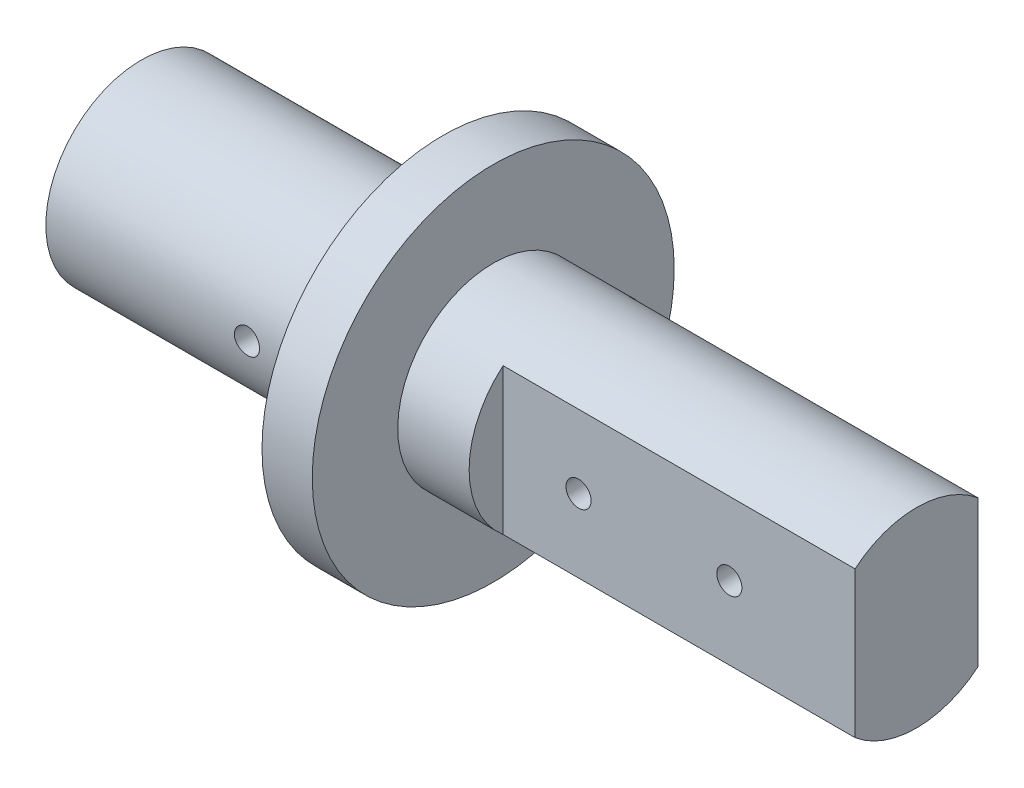
from build123d import *
from build123d.topology import SkipClean

# Parameters (mm, degrees)
SKETCH1_W                           = 42.1
SKETCH1_H                           = 10
BOSS_EXTRUDE1_START                 = 30
BOSS_EXTRUDE1_DEPTH                 = 30
BOSS_EXTRUDE2_START                 = -7.1
SKETCH8_R                           = 18
BOSS_EXTRUDE2_DEPTH                 = 5
M3X0_5_TAPPED_HOLE3_D               = 2.5
M3X0_5_TAPPED_HOLE3_DEPTH           = 10
M3X0_5_TAPPED_HOLE3_TIP             = 0.751076
M3X0_5_TAPPED_HOLE2_D               = 2.5
M3X0_5_TAPPED_HOLE2_DEPTH           = 5
M3X0_5_TAPPED_HOLE2_TIP             = 0.751076
M3X0_5_TAPPED_HOLE2_ON_FACE_2_D     = 2.5
M3X0_5_TAPPED_HOLE2_ON_FACE_2_DEPTH = 5
M3X0_5_TAPPED_HOLE2_ON_FACE_2_TIP   = 0.751076
BOSS_EXTRUDE3_START                 = 5
BOSS_EXTRUDE3_DEPTH                 = 5
TOLERANCING_START                   = 42.1
TOLERANCING_DEPTH                   = 35
TOLERANCING_2_OUTLINE_R             = 10
TOLERANCING_2_OUTLINE_R_2           = 9.5
TOLERANCING_2_DEPTH                 = 30
TOLERANCING_START_2                 = 35
TOLERANCING_3_OUTLINE_R             = 10
TOLERANCING_3_OUTLINE_R_2           = 9.5
TOLERANCING_3_DEPTH                 = 7.1


# Read off the part's stored shape, not the designer's step: Tolerancing
with BuildPart() as part:
    # Sketch1 → Revolve1 (revolve)
    with BuildSketch(Plane.XY, mode=Mode.PRIVATE) as revolve1_sk:
        with Locations((21.05, 5)):
            Rectangle(SKETCH1_W, SKETCH1_H)
    revolve(revolve1_sk.sketch.rotate(Axis((0, 0, 0), (1, 0, 0)), 90), axis=Axis((0, 0, 0), (1, 0, 0)))

    # Sketch3 → Boss-Extrude1 (add)
    with BuildSketch(Plane(origin=(42.1, 0, 0), x_dir=(0, 0, -1), z_dir=(1, 0, 0)).offset(BOSS_EXTRUDE1_START)):
        with BuildLine():
            Line((-6.614378, -7.5), (-6.614378, 7.5))
            ThreePointArc((-6.614378, 7.5), (0, 10), (6.614378, 7.5))
            Line((6.614378, 7.5), (6.614378, -7.5))
            ThreePointArc((6.614378, -7.5), (0, -10), (-6.614378, -7.5))
        make_face()
    extrude(amount=-BOSS_EXTRUDE1_DEPTH)

    # Sketch8 → Boss-Extrude2 (add)
    with BuildSketch(Plane(origin=(42.1, 0, 0), x_dir=(0, 0, -1), z_dir=(1, 0, 0)).offset(BOSS_EXTRUDE2_START)):
        Circle(SKETCH8_R)
    extrude(amount=-BOSS_EXTRUDE2_DEPTH)

    # M3x0.5 Tapped Hole3
    with Locations(Plane.XY.offset(10)):
        with Locations((20, 0)):
            Hole(M3X0_5_TAPPED_HOLE3_D / 2, depth=M3X0_5_TAPPED_HOLE3_DEPTH)
            with Locations((0, 0, -(M3X0_5_TAPPED_HOLE3_DEPTH + M3X0_5_TAPPED_HOLE3_TIP / 2))):  # 118° drill point
                Cone(0, M3X0_5_TAPPED_HOLE3_D / 2, M3X0_5_TAPPED_HOLE3_TIP, mode=Mode.SUBTRACT)

    # M3x0.5 Tapped Hole2
    with Locations(Plane(origin=(49.6, 0, 6.614378), x_dir=(1, 0, 0), z_dir=(0, 0, 1))):
        with Locations((0, 0), (15, 0)):
            Hole(M3X0_5_TAPPED_HOLE2_D / 2, depth=M3X0_5_TAPPED_HOLE2_DEPTH)
            with Locations((0, 0, -(M3X0_5_TAPPED_HOLE2_DEPTH + M3X0_5_TAPPED_HOLE2_TIP / 2))):  # 118° drill point
                Cone(0, M3X0_5_TAPPED_HOLE2_D / 2, M3X0_5_TAPPED_HOLE2_TIP, mode=Mode.SUBTRACT)

    # M3x0.5 Tapped Hole2 on face 2
    with Locations(Plane(origin=(64.6, 0, -6.614378), x_dir=(-1, 0, 0), z_dir=(0, 0, -1))):
        with Locations((0, 0), (15, 0)):
            Hole(M3X0_5_TAPPED_HOLE2_ON_FACE_2_D / 2, depth=M3X0_5_TAPPED_HOLE2_ON_FACE_2_DEPTH)
            with Locations((0, 0, -(M3X0_5_TAPPED_HOLE2_ON_FACE_2_DEPTH + M3X0_5_TAPPED_HOLE2_ON_FACE_2_TIP / 2))):  # 118° drill point
                Cone(0, M3X0_5_TAPPED_HOLE2_ON_FACE_2_D / 2, M3X0_5_TAPPED_HOLE2_ON_FACE_2_TIP, mode=Mode.SUBTRACT)

    # Sketch9 → Boss-Extrude3 (add)
    with SkipClean():  # the faces are left unmerged after this step: merging them gives an invalid solid
        with BuildSketch(Plane(origin=(72.1, 0, 0), x_dir=(0, 0, -1), z_dir=(1, 0, 0)).offset(BOSS_EXTRUDE3_START)):
            with BuildLine():
                Line((6.614378, -7.5), (6.614378, 7.5))
                ThreePointArc((6.614378, 7.5), (0, 10), (-6.614378, 7.5))
                Line((-6.614378, 7.5), (-6.614378, -7.5))
                ThreePointArc((-6.614378, -7.5), (0, -10), (6.614378, -7.5))
            make_face()
        extrude(amount=-BOSS_EXTRUDE3_DEPTH)

    # Tolerancing outline → Tolerancing (cut)
    with BuildSketch(Plane.YZ.offset(TOLERANCING_START)):
        with BuildLine():
            Line((7.5, 6.614378), (-7.5, 6.614378))
            ThreePointArc((-7.5, 6.614378), (-10, 0), (-7.5, -6.614378))
            Line((-7.5, -6.614378), (7.5, -6.614378))
            ThreePointArc((7.5, -6.614378), (10, 0), (7.5, 6.614378))
        make_face()
        with BuildLine():
            ThreePointArc((7.270789, 6.114378), (9.5, 0), (7.270789, -6.114378))
            Line((7.270789, -6.114378), (-7.270789, -6.114378))
            ThreePointArc((-7.270789, -6.114378), (-9.5, 0), (-7.270789, 6.114378))
            Line((-7.270789, 6.114378), (7.270789, 6.114378))
        make_face(mode=Mode.SUBTRACT)
    extrude(amount=TOLERANCING_DEPTH, mode=Mode.SUBTRACT)

    # Tolerancing 2 outline → Tolerancing 2 (cut)
    with BuildSketch(Plane.YZ):
        Circle(TOLERANCING_2_OUTLINE_R)
        Circle(TOLERANCING_2_OUTLINE_R_2, mode=Mode.SUBTRACT)
    extrude(amount=TOLERANCING_2_DEPTH, mode=Mode.SUBTRACT)

    # Tolerancing 3 outline → Tolerancing 3 (cut)
    with BuildSketch(Plane.YZ.offset(TOLERANCING_START_2)):
        Circle(TOLERANCING_3_OUTLINE_R)
        Circle(TOLERANCING_3_OUTLINE_R_2, mode=Mode.SUBTRACT)
    extrude(amount=TOLERANCING_3_DEPTH, mode=Mode.SUBTRACT)


solid = part.part
